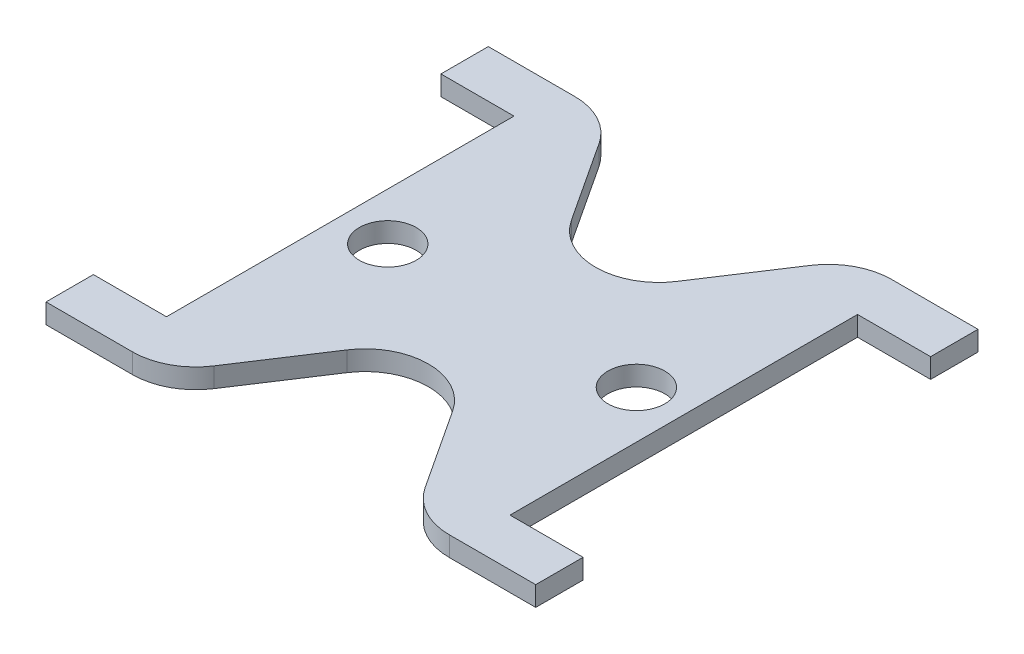
from build123d import *

# Parameters (mm, degrees)
SKETCH2_R           = 2.286
BOSS_EXTRUDE1_DEPTH = 1.5875
FILLET1_R           = 5.08


with BuildPart() as part:
    # Sketch2 → Boss-Extrude1 (new body)
    with BuildSketch(Plane.XZ.offset(32.657932219)):
        Polygon((10.109157694, -15.832760328), (13.919157694, -15.832760328), (19.794157694, -15.832760328), (19.794157694, -12.022760328), (13.919157694, -12.022760328), (13.919157694, 15.917239672), (19.794157694, 15.917239672), (19.794157694, 19.727239672), (13.919157694, 19.727239672), (10.109157694, 19.727239672), (0.109157694, 4.487239672), (-9.879450107, 19.727239672), (-13.700842306, 19.727239672), (-19.575842306, 19.727239672), (-19.575842306, 15.917239672), (-13.700842306, 15.917239672), (-13.700842306, -12.022760328), (-19.575842306, -12.022760328), (-19.575842306, -15.832760328), (-13.700842306, -15.832760328), (-9.879450107, -15.832760328), (0.109157694, -0.592760328), align=None)
        with Locations((-9.879450107, 1.947239672)):
            Circle(SKETCH2_R, mode=Mode.SUBTRACT)
        with Locations((10.109157694, 1.947239672)):
            Circle(SKETCH2_R, mode=Mode.SUBTRACT)
    extrude(amount=BOSS_EXTRUDE1_DEPTH)

    # Fillet1
    fillet1_edges = [part.edges().sort_by_distance(p)[0] for p in [
        (10.109157694, -33.451682219, -15.832760328),
        (-9.879450107, -33.451682219, -15.832760328),
        (10.109157694, -33.451682219, 19.727239672),
        (-9.879450107, -33.451682219, 19.727239672),
        (0.109157694, -33.451682219, 4.487239672),
        (0.109157694, -33.451682219, -0.592760328),
    ]]
    fillet(fillet1_edges, radius=FILLET1_R)


solid = part.part
